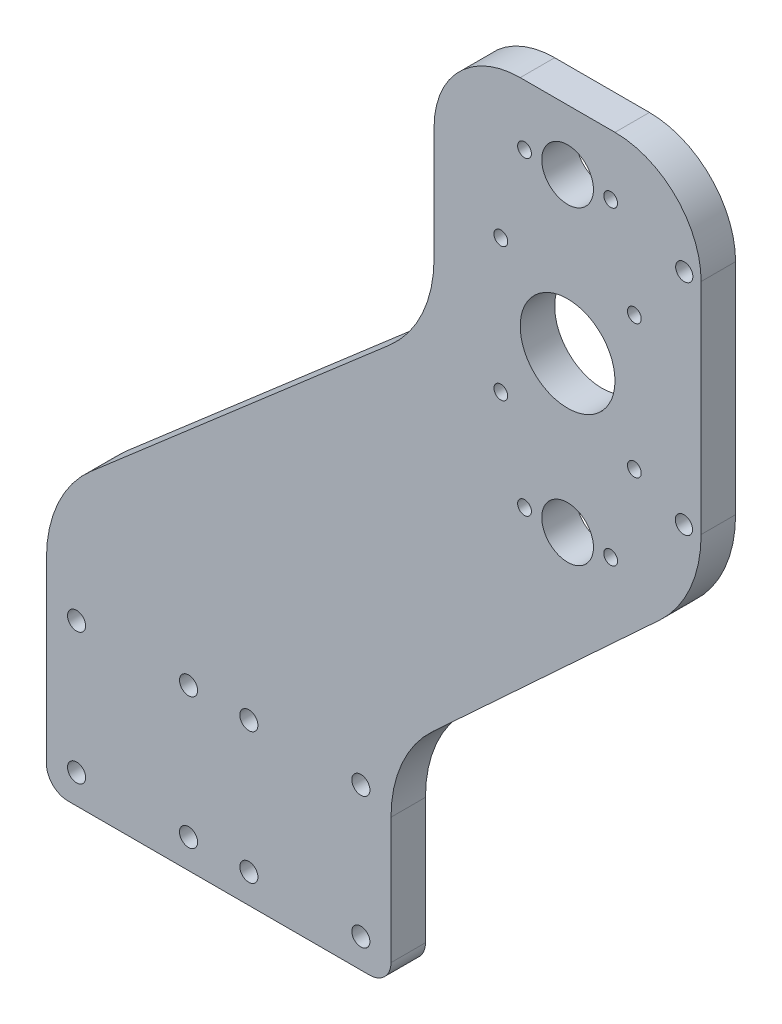
from build123d import *

# Parameters (mm, degrees)
SKETCH1_R           = 2.1
SKETCH1_R_2         = 6
SKETCH1_R_3         = 11
SKETCH1_R_4         = 1.6
SKETCH1_R_5         = 2
BOSS_EXTRUDE1_DEPTH = 8


with BuildPart() as part:
    # Sketch1 → Boss-Extrude1 (new body)
    with BuildSketch(Plane.XY):
        with BuildLine():
            Line((-58.731017158, -89.445111827), (11.268982842, -89.445111827))
            ThreePointArc((11.268982842, -89.445111827), (14.804516748, -87.980645733), (16.268982842, -84.445111827))
            Line((16.268982842, -84.445111827), (16.268982842, -55.206132823))
            ThreePointArc((16.268982842, -55.206132823), (18.781371957, -43.188177597), (25.897732696, -33.18314103))
            Line((25.897732696, -33.18314103), (78.640232988, 15.603630397))
            ThreePointArc((78.640232988, 15.603630397), (85.756593727, 25.608666964), (88.268982842, 37.62662219))
            Line((88.268982842, 37.62662219), (88.268982842, 88.499564037))
            ThreePointArc((88.268982842, 88.499564037), (82.411118466, 102.641699661), (68.268982842, 108.499564037))
            Line((68.268982842, 108.499564037), (46.268982842, 108.499564037))
            ThreePointArc((46.268982842, 108.499564037), (32.126847218, 102.641699661), (26.268982842, 88.499564037))
            Line((26.268982842, 88.499564037), (26.268982842, 62.204796523))
            ThreePointArc((26.268982842, 62.204796523), (23.556329958, 49.738815318), (15.908937016, 39.527226105))
            Line((15.908937016, 39.527226105), (-53.370971331, -20.472773895))
            ThreePointArc((-53.370971331, -20.472773895), (-61.018364273, -30.684363108), (-63.731017158, -43.150344313))
            Line((-63.731017158, -43.150344313), (-63.731017158, -84.445111827))
            ThreePointArc((-63.731017158, -84.445111827), (-62.266551064, -87.980645733), (-58.731017158, -89.445111827))
        make_face()
        with Locations((-56.731017158, -52.195111827)):
            Circle(SKETCH1_R, mode=Mode.SUBTRACT)
        with Locations((-30.731017158, -52.195111827)):
            Circle(SKETCH1_R, mode=Mode.SUBTRACT)
        with Locations((-30.731017158, -82.695111827)):
            Circle(SKETCH1_R, mode=Mode.SUBTRACT)
        with Locations((-56.731017158, -82.695111827)):
            Circle(SKETCH1_R, mode=Mode.SUBTRACT)
        with Locations((9.268982842, -82.695111827)):
            Circle(SKETCH1_R, mode=Mode.SUBTRACT)
        with Locations((-16.731017158, -82.695111827)):
            Circle(SKETCH1_R, mode=Mode.SUBTRACT)
        with Locations((-16.731017158, -52.195111827)):
            Circle(SKETCH1_R, mode=Mode.SUBTRACT)
        with Locations((9.268982842, -52.195111827)):
            Circle(SKETCH1_R, mode=Mode.SUBTRACT)
        with Locations((57.268982842, 94.499564037)):
            Circle(SKETCH1_R_2, mode=Mode.SUBTRACT)
        with Locations((57.268982842, 22.559564037)):
            Circle(SKETCH1_R_2, mode=Mode.SUBTRACT)
        with Locations((57.268982842, 58.529564037)):
            Circle(SKETCH1_R_3, mode=Mode.SUBTRACT)
        with Locations((41.768982842, 74.029564037)):
            Circle(SKETCH1_R_4, mode=Mode.SUBTRACT)
        with Locations((72.768982842, 74.029564037)):
            Circle(SKETCH1_R_4, mode=Mode.SUBTRACT)
        with Locations((72.768982842, 43.029564037)):
            Circle(SKETCH1_R_4, mode=Mode.SUBTRACT)
        with Locations((41.768982842, 43.029564037)):
            Circle(SKETCH1_R_4, mode=Mode.SUBTRACT)
        with Locations((84.268982842, 37.62662219)):
            Circle(SKETCH1_R_5, mode=Mode.SUBTRACT)
        with Locations((84.351781192, 88.518513838)):
            Circle(SKETCH1_R_5, mode=Mode.SUBTRACT)
        with Locations((47.268982842, 94.499564037)):
            Circle(SKETCH1_R_4, mode=Mode.SUBTRACT)
        with Locations((47.268982842, 22.559564037)):
            Circle(SKETCH1_R_4, mode=Mode.SUBTRACT)
        with Locations((67.268982842, 94.499564037)):
            Circle(SKETCH1_R_4, mode=Mode.SUBTRACT)
        with Locations((67.268982842, 22.559564037)):
            Circle(SKETCH1_R_4, mode=Mode.SUBTRACT)
    extrude(amount=BOSS_EXTRUDE1_DEPTH)


solid = part.part
